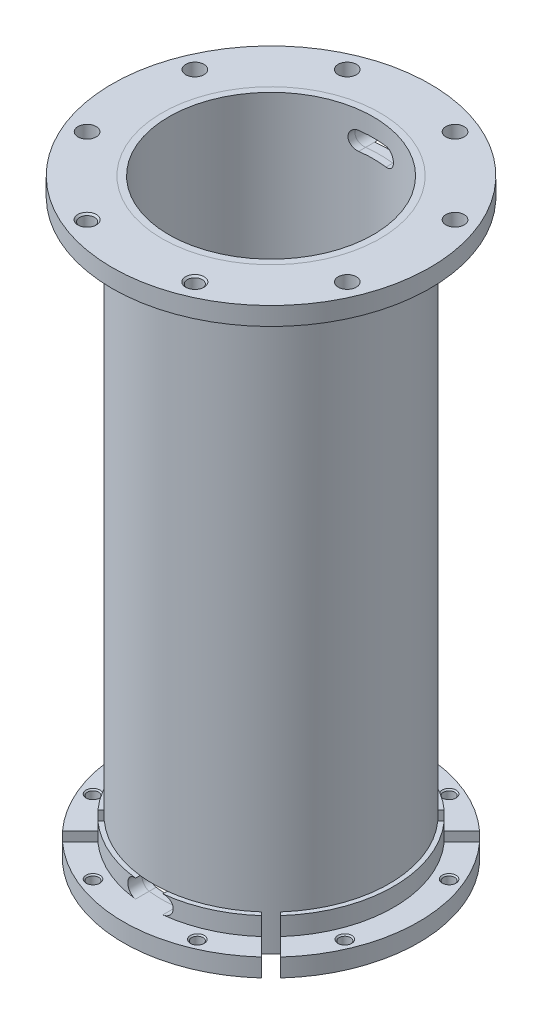
from build123d import *

# Parameters (mm, degrees)
SKETCH1_R                      = 24
SKETCH1_R_2                    = 22.5
BOSS_EXTRUDE1_DEPTH            = 130
SKETCH4_R                      = 2
CUT_EXTRUDE1_DEPTH             = 4
M4X0_7_TAPPED_HOLE1_AT_2_COUNT = 2
M4X0_7_TAPPED_HOLE1_AT_2_PITCH = 23.726372807
CUT_EXTRUDE2_START             = -8
CUT_EXTRUDE2_DEPTH             = 8
CIRPATTERN1_COUNT              = 4
CUT_EXTRUDE3_DEPTH             = 140.104277432
CUT_EXTRUDE3_DEPTH_BACK        = 140.104277432
CIRPATTERN2_COUNT              = 8


# Read off the part's stored shape, not the designer's step: Cut-Extrude2
with BuildPart() as part:
    # Sketch1 → Boss-Extrude1 (new body)
    with BuildSketch(Plane(origin=(0, 0, 0), x_dir=(1, 0, 0), z_dir=(0, 1, 0))):
        with Locations(Location((0, 0, 0), (0, 0, 270))):
            Circle(SKETCH1_R)
        with Locations(Location((0, 0, 0), (0, 0, 270))):
            Circle(SKETCH1_R_2, mode=Mode.SUBTRACT)
    extrude(amount=BOSS_EXTRUDE1_DEPTH)


with BuildPart() as body_2:
    # Sketch3 → Revolve1 (revolve)
    with BuildSketch(Plane.XY, mode=Mode.PRIVATE) as revolve1_sk:
        Polygon((-26, 8), (-26, 122), (-27, 122), (-27, 126), (-35, 126), (-35, 130), (-24, 130), (-24, 0), (-32.5, 0), (-32.5, 4), (-27, 4), (-27, 8), align=None)
    revolve(revolve1_sk.sketch.rotate(Axis((0, 170.888668253, 0), (0, -1, 0)), 270), axis=Axis((0, 170.888668253, 0), (0, -1, 0)))

    # Sketch4 → Cut-Extrude1 (cut)
    with BuildSketch(Plane(origin=(0, 130, 0), x_dir=(1, 0, 0), z_dir=(0, 1, 0))):
        with Locations(Location((11.863186403, 28.640265508, 0), (0, 0, 270))):
            Circle(SKETCH4_R)
        with Locations(Location((28.640265508, 11.863186403, 0), (0, 0, 270))):
            Circle(SKETCH4_R)
        with Locations(Location((28.640265508, -11.863186403, 0), (0, 0, 270))):
            Circle(SKETCH4_R)
        with Locations(Location((-28.640265508, -11.863186403, 0), (0, 0, 270))):
            Circle(SKETCH4_R)
        with Locations(Location((-28.640265508, 11.863186403, 0), (0, 0, 270))):
            Circle(SKETCH4_R)
        with Locations(Location((-11.863186403, 28.640265508, 0), (0, 0, 270))):
            Circle(SKETCH4_R)
    extrude(amount=-CUT_EXTRUDE1_DEPTH, mode=Mode.SUBTRACT)

    # Sketch8 → M4x0.7 Tapped Hole1 (revolve, cut)
    with BuildSketch(Plane(origin=(11.863186403, 130, 28.640265508), x_dir=(0, 0, 1), z_dir=(1, 0, 0))):
        Polygon((0, 0), (0, 4.001), (1.65, 4.001), (1.65, 0.375), (2.025, 0), align=None)
    m4x0_7_tapped_hole1 = revolve(axis=Axis((11.863186403, 136.35, 28.640265508), (0, -1, 0)), mode=Mode.SUBTRACT)

    # M4x0.7 Tapped Hole1 at 2: M4x0.7 Tapped Hole1 ×2
    with Locations(*[(-i * M4X0_7_TAPPED_HOLE1_AT_2_PITCH, 0, 0) for i in range(1, M4X0_7_TAPPED_HOLE1_AT_2_COUNT)]):
        add(m4x0_7_tapped_hole1, mode=Mode.SUBTRACT)

    # Cut-Extrude2 outline → Cut-Extrude2 (cut)
    with BuildSketch(Plane(origin=(0, 8, 0), x_dir=(1, 0, 0), z_dir=(0, 1, 0)).offset(CUT_EXTRUDE2_START)):
        with BuildLine():
            ThreePointArc((21.895820395, -24.017140738), (22.980970389, -22.980970389), (24.017140738, -21.895820395))
            Line((24.017140738, -21.895820395), (19.414815015, -17.293494671))
            ThreePointArc((19.414815015, -17.293494671), (18.384776311, -18.384776311), (17.293494671, -19.414815015))
            Line((17.293494671, -19.414815015), (21.895820395, -24.017140738))
        make_face()
    cut_extrude2 = extrude(amount=CUT_EXTRUDE2_DEPTH, mode=Mode.SUBTRACT)

    # CirPattern1: Cut-Extrude2 ×4 about axis
    cirpattern1_axis = Axis((0, 0, 0), (0, 1, 0))
    for i in range(1, CIRPATTERN1_COUNT):
        add(cut_extrude2.rotate(cirpattern1_axis, i * 360 / CIRPATTERN1_COUNT), mode=Mode.SUBTRACT)


with BuildPart() as cut_extrude3_tool:
    # Sketch11 → Cut-Extrude3 (new, two sides: drawn at the far end of the back side and taken through both)
    with BuildSketch(Plane.XY.offset(-CUT_EXTRUDE3_DEPTH_BACK)):
        with BuildLine():
            Line((-3, 126), (3, 126))
            ThreePointArc((3, 126), (5, 124), (3, 122))
            Line((3, 122), (-3, 122))
            ThreePointArc((-3, 122), (-5, 124), (-3, 126))
        make_face()
        with BuildLine():
            Line((-3, 4), (3, 4))
            ThreePointArc((3, 4), (5, 6), (3, 8))
            Line((3, 8), (-3, 8))
            ThreePointArc((-3, 8), (-5, 6), (-3, 4))
        make_face()
    extrude(amount=CUT_EXTRUDE3_DEPTH + CUT_EXTRUDE3_DEPTH_BACK)


with BuildPart() as part_1:
    add(part.part)

    # Cut-Extrude3: cut by cut_extrude3_tool
    add(cut_extrude3_tool.part, mode=Mode.SUBTRACT)


with BuildPart() as body_2_1:
    add(body_2.part)

    # Cut-Extrude3: cut by cut_extrude3_tool
    add(cut_extrude3_tool.part, mode=Mode.SUBTRACT)

    # Sketch16 → M3x0.5 Tapped Hole2 (revolve, cut)
    with BuildSketch(Plane(origin=(11.480502971, 4, -27.716385975), x_dir=(0, 0, 1), z_dir=(1, 0, 0))):
        Polygon((0, 0), (0, 4.001), (1.25, 4.001), (1.25, 0.275), (1.525, 0), align=None)
    m3x0_5_tapped_hole2 = revolve(axis=Axis((11.480502971, 10.35, -27.716385975), (0, -1, 0)), mode=Mode.SUBTRACT)

    # CirPattern2: M3x0.5 Tapped Hole2 ×8 about axis
    cirpattern2_axis = Axis((0, 0, 0), (0, 1, 0))
    for i in range(1, CIRPATTERN2_COUNT):
        add(m3x0_5_tapped_hole2.rotate(cirpattern2_axis, i * 360 / CIRPATTERN2_COUNT), mode=Mode.SUBTRACT)


solid = Compound([part_1.part, body_2_1.part])
